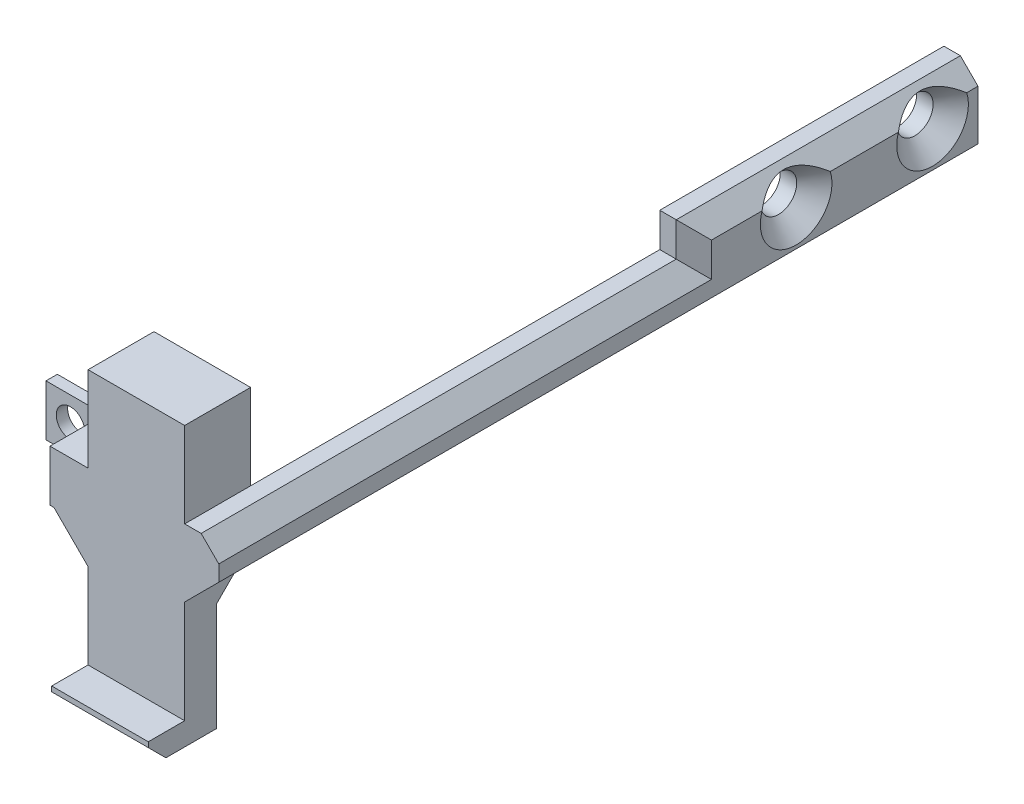
from build123d import *

# Parameters (mm, degrees)
SKETCH1_R           = 1.25
BOSS_EXTRUDE1_DEPTH = 1
BOSS_EXTRUDE2_DEPTH = 8
CUT_EXTRUDE1_DEPTH  = 3.2
SKETCH4_R           = 1.6
BOSS_EXTRUDE3_DEPTH = 3
CHAMFER1_SIZE       = 1.55
CHAMFER2_SIZE       = 1.55
CHAMFER3_SIZE       = 1.55
SKETCH5_W           = 8.5
SKETCH5_H           = 12.5
CUT_EXTRUDE2_DEPTH  = 3
CHAMFER4_SIZE       = 3
CHAMFER5_SIZE       = 1.45
SKETCH6_W           = 8.5
SKETCH6_H           = 3.2
CUT_EXTRUDE3_DEPTH  = 69.023892861


# Some blends are built 0.0001 mm under size
with BuildPart() as part:
    # Sketch1 → Boss-Extrude1 (new body)
    with BuildSketch(Plane.XY):
        Polygon((0, 0), (0, 4.5), (8.5, 4.5), (8.5, 12), (17, 12), (17, 0), (17, -12.5), (8.5, -12.5), (8.5, 0), align=None)
        with Locations((2.15, 2.35)):
            Circle(SKETCH1_R, mode=Mode.SUBTRACT)
    extrude(amount=BOSS_EXTRUDE1_DEPTH)

    # Sketch2 → Boss-Extrude2 (add)
    with BuildSketch(Plane.XY.offset(1)):
        Polygon((5.15, 4.5), (5.15, 0), (8.5, 0), (8.5, -12.5), (17, -12.5), (17, 12), (8.5, 12), (8.5, 4.5), align=None)
    extrude(amount=BOSS_EXTRUDE2_DEPTH)

    # Sketch3 → Cut-Extrude1 (cut)
    with BuildSketch(Plane.XY.offset(9)):
        Polygon((8.5, 10), (17, 10), (17, -10.5), (8.5, -10.5), (5.15, -10.5), (5.15, 4.5), (8.5, 4.5), align=None)
    extrude(amount=-CUT_EXTRUDE1_DEPTH, mode=Mode.SUBTRACT)

    # Sketch4 → Boss-Extrude3 (add)
    with BuildSketch(Plane(origin=(17, 0, 0), x_dir=(0, 0, -1), z_dir=(1, 0, 0))):
        Polygon((-5.8, 0), (61, 0), (61, 4.5), (61, 7.5), (36, 7.5), (36, 4.5), (-5.8, 4.5), align=None)
        with Locations(Location((57, 5, 0), (0, 0, 90))):
            Circle(SKETCH4_R, mode=Mode.SUBTRACT)
        with Locations(Location((45, 5, 0), (0, 0, 90))):
            Circle(SKETCH4_R, mode=Mode.SUBTRACT)
    extrude(amount=BOSS_EXTRUDE3_DEPTH)

    # Chamfer1
    # the kernel refuses this chamfer: 1.55 mm, written as the material it takes off along each edge
    with BuildSketch(Plane(origin=(20, 5, -57), x_dir=(0, 1, 0), z_dir=(0, 0, -1))) as chamfer1_piece_1:
        Polygon((1.6, -CHAMFER1_SIZE), (1.6 + CHAMFER1_SIZE, 0), (1.6, 0), align=None)
    revolve(axis=Axis((20, 5, -57), (1, 0, 0)), mode=Mode.SUBTRACT)
    with BuildSketch(Plane(origin=(20, 5, -45), x_dir=(0, 1, 0), z_dir=(0, 0, -1))) as chamfer1_piece_2:
        Polygon((1.6, -CHAMFER1_SIZE), (1.6 + CHAMFER1_SIZE, 0), (1.6, 0), align=None)
    revolve(axis=Axis((20, 5, -45), (1, 0, 0)), mode=Mode.SUBTRACT)

    # Chamfer2
    # the kernel refuses this chamfer: 1.55 mm, written as the material it takes off along each edge
    with BuildSketch(Plane(origin=(20, 7.5, -59.069731842), x_dir=(0.027495876610587087, -0.9996219169112966, 0), z_dir=(0, 0, 1))) as chamfer2_piece_1:
        Polygon((CHAMFER2_SIZE * 0.999621916911, -CHAMFER2_SIZE * 0.0274958766106), (-CHAMFER2_SIZE * 0.0274958766106, -CHAMFER2_SIZE * 0.999621916911), (0, 0), align=None)
    extrude(amount=16.139463683, mode=Mode.SUBTRACT)
    with BuildSketch(Plane(origin=(20, 7.5, -47.069731842), x_dir=(0.027495876610587087, -0.9996219169112966, 0), z_dir=(0, 0, 1))) as chamfer2_piece_2:
        Polygon((CHAMFER2_SIZE * 0.999621916911, -CHAMFER2_SIZE * 0.0274958766106), (-CHAMFER2_SIZE * 0.0274958766106, -CHAMFER2_SIZE * 0.999621916911), (0, 0), align=None)
    extrude(amount=15.055840473, mode=Mode.SUBTRACT)
    with BuildSketch(Plane(origin=(20.986108631, 12, 9), x_dir=(0, 0.02749587661058596, -0.9996219169112966), z_dir=(-1, 0, 0))) as chamfer2_piece_3:
        Polygon((CHAMFER2_SIZE * 0.999621916911, CHAMFER2_SIZE * 0.0274958766106), (-CHAMFER2_SIZE * 0.0274958766106, CHAMFER2_SIZE * 0.999621916911), (0, 0), align=None)
    extrude(amount=16.472217263, mode=Mode.SUBTRACT)
    with BuildSketch(Plane(origin=(20, 7.5, -64.986108631), x_dir=(0.027495876610587087, -0.9996219169112966, 0), z_dir=(0, 0, 1))) as chamfer2_piece_4:
        Polygon((CHAMFER2_SIZE * 0.999621916911, -CHAMFER2_SIZE * 0.0274958766106), (-CHAMFER2_SIZE * 0.0274958766106, -CHAMFER2_SIZE * 0.999621916911), (0, 0), align=None)
    extrude(amount=10.055840473, mode=Mode.SUBTRACT)
    with BuildSketch(Plane(origin=(20, 11.486108631, -36), x_dir=(0.027495876610587163, 0, -0.9996219169112966), z_dir=(0, -1, 0))) as chamfer2_piece_5:
        Polygon((CHAMFER2_SIZE * 0.999621916911, -CHAMFER2_SIZE * 0.0274958766106), (-CHAMFER2_SIZE * 0.0274958766106, -CHAMFER2_SIZE * 0.999621916911), (0, 0), align=None)
    extrude(amount=6.986108631, mode=Mode.SUBTRACT)
    with BuildSketch(Plane(origin=(20, 4.5, -36), x_dir=(-0.9996219169112966, 0.027495876610585928, 0), z_dir=(0, 0, 1))) as chamfer2_piece_6:
        Polygon((CHAMFER2_SIZE * 0.999621916911, CHAMFER2_SIZE * 0.0274958766106), (-CHAMFER2_SIZE * 0.0274958766106, CHAMFER2_SIZE * 0.999621916911), (0, 0), align=None)
    extrude(amount=45.786108631, mode=Mode.SUBTRACT)
    with BuildSketch(Plane(origin=(20, 4.5, -39.986108631), x_dir=(-0.9996219169112966, 0.027495876610585928, 0), z_dir=(0, 0, 1))) as chamfer2_piece_7a_section:
        Polygon((CHAMFER2_SIZE * 0.999621916911, CHAMFER2_SIZE * 0.0274958766106), (-CHAMFER2_SIZE * 0.0274958766106, CHAMFER2_SIZE * 0.999621916911), (0, 0), align=None)
    chamfer2_piece_7a = extrude(amount=49.772217263, mode=Mode.PRIVATE)
    chamfer2_piece_7a = split(chamfer2_piece_7a, bisect_by=Plane(origin=(19.488819878, 3.988819878, -36), z_dir=(0, 0, -1)), keep=Keep.TOP, mode=Mode.PRIVATE)
    with BuildSketch(Plane(origin=(20, 11.486108631, -36), x_dir=(0.027495876610587163, 0, -0.9996219169112966), z_dir=(0, -1, 0))) as chamfer2_piece_7b_section:
        Polygon((CHAMFER2_SIZE * 0.999621916911, -CHAMFER2_SIZE * 0.0274958766106), (-CHAMFER2_SIZE * 0.0274958766106, -CHAMFER2_SIZE * 0.999621916911), (0, 0), align=None)
    chamfer2_piece_7b = extrude(amount=10.972217263, mode=Mode.PRIVATE)
    chamfer2_piece_7b = split(chamfer2_piece_7b, bisect_by=Plane(origin=(19.488819878, 4.5, -36.511180122), z_dir=(0, -1, 0)), keep=Keep.TOP, mode=Mode.PRIVATE)
    chamfer2_piece_7 = chamfer2_piece_7a & chamfer2_piece_7b
    add(chamfer2_piece_7, mode=Mode.SUBTRACT)

    # Chamfer3
    chamfer3_edges = [part.edges().sort_by_distance(p)[0] for p in [
        (12.75, -12.5, 9),
        (20, 0, -27.6),
    ]]
    chamfer(chamfer3_edges, length=CHAMFER3_SIZE)

    # Sketch5 → Cut-Extrude2 (cut)
    with BuildSketch(Plane(origin=(0, 0, 0), x_dir=(-1, 0, 0), z_dir=(0, 0, -1))):
        with Locations((-12.75, -6.25)):
            Rectangle(SKETCH5_W, SKETCH5_H)
    extrude(amount=-CUT_EXTRUDE2_DEPTH, mode=Mode.SUBTRACT)

    # Chamfer4
    chamfer4_edges = [part.edges().sort_by_distance(p)[0] for p in [
        (12.75, 0, 3),
        (8.5, 0, 4.4),
    ]]
    chamfer(chamfer4_edges, length=CHAMFER4_SIZE - 0.0001)  # a hair under: the kernel refuses the full size

    # Chamfer5
    chamfer5_edges = [part.edges().sort_by_distance(p)[0] for p in [
        (17, 0, 2.90005),
    ]]
    chamfer(chamfer5_edges, length=CHAMFER5_SIZE - 0.0001)  # a hair under: the kernel refuses the full size
    chamfer5_2_edges = [part.edges().sort_by_distance(p)[0] for p in [
        (18.44995, 0, 5.8),
    ]]
    chamfer(chamfer5_2_edges, length=CHAMFER5_SIZE)

    # Sketch6 → Cut-Extrude3 (cut, through all)
    with BuildSketch(Plane.XZ.offset(-10)):
        with Locations((12.75, 7.4)):
            Rectangle(SKETCH6_W, SKETCH6_H)
    extrude(amount=-CUT_EXTRUDE3_DEPTH, mode=Mode.SUBTRACT)


solid = part.part
